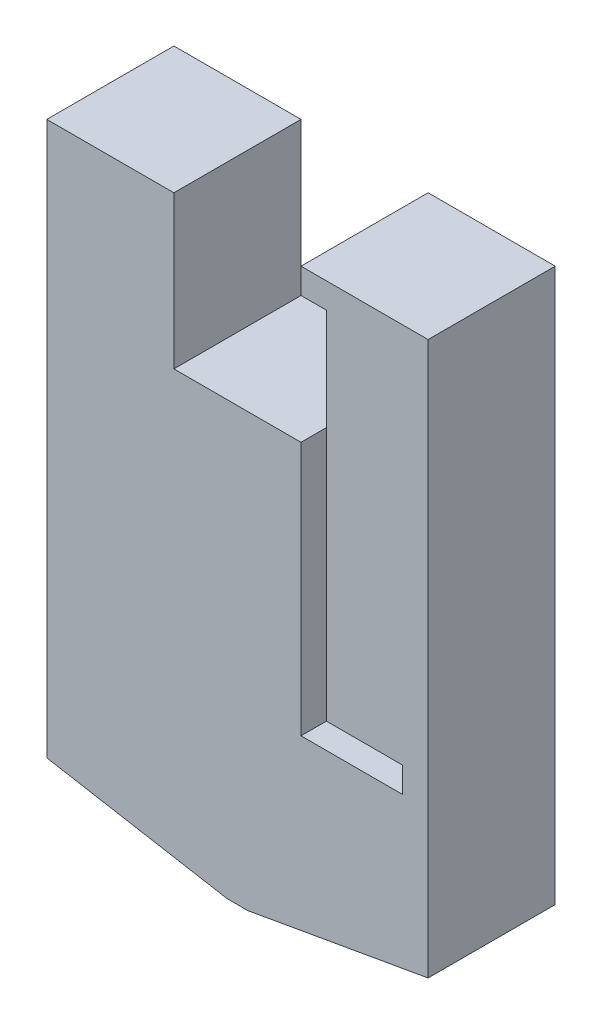
from build123d import *

# Parameters (mm, degrees)
SKETCH2_W           = 19.05
SKETCH2_H           = 31.75
BOSS_EXTRUDE1_DEPTH = 3.175
CUT_EXTRUDE1_DEPTH  = 23.857707289
CUT_EXTRUDE2_DEPTH  = 23.857707289
CUT_EXTRUDE3_DEPTH  = 20.572014459


with BuildPart() as part:
    # Sketch2 → Boss-Extrude1 (new, symmetric)
    with BuildSketch(Plane.XY):
        Rectangle(SKETCH2_W, SKETCH2_H)
    extrude(amount=BOSS_EXTRUDE1_DEPTH, both=True)

    # Sketch4 → Cut-Extrude1 (cut, through all)
    with BuildSketch(Plane(origin=(-1.506852909, 3.110534069, 3.175), x_dir=(1, 0, 0), z_dir=(0, 0, 1))):
        Polygon((-8.018147091, 12.764465931), (-8.018147091, 10.224465931), (-1.668147091, 10.224465931), (-1.668147091, 2.604465931), (4.681852909, 2.604465931), (4.681852909, 10.224465931), (11.031852909, 10.224465931), (11.031852909, 12.764465931), align=None)
    extrude(amount=-CUT_EXTRUDE1_DEPTH, mode=Mode.SUBTRACT)

    # Sketch6 → Cut-Extrude2 (cut, through all)
    with BuildSketch(Plane(origin=(-1.506852909, 3.110534069, 3.175), x_dir=(1, 0, 0), z_dir=(0, 0, 1))):
        Polygon((5.951852909, 8.954465931), (4.681852909, 8.954465931), (4.681852909, -10.095534069), (9.761852909, -10.095534069), (9.761852909, -8.825534069), (5.951852909, -8.825534069), align=None)
    extrude(amount=-CUT_EXTRUDE2_DEPTH, mode=Mode.SUBTRACT)

    # Sketch7 → Cut-Extrude3 (cut, through all)
    with BuildSketch(Plane.XY.offset(3.175)):
        Polygon((-9.525, -14.2875), (-0.521840111, -15.875), (-9.525, -15.875), align=None)
    cut_extrude3 = extrude(amount=-CUT_EXTRUDE3_DEPTH, mode=Mode.SUBTRACT)

    # Mirror1: Cut-Extrude3 across plane
    add(cut_extrude3.mirror(Plane(origin=(0, 0, 0), x_dir=(0, 0, 1), z_dir=(1, 0, 0))), mode=Mode.SUBTRACT)


solid = part.part
